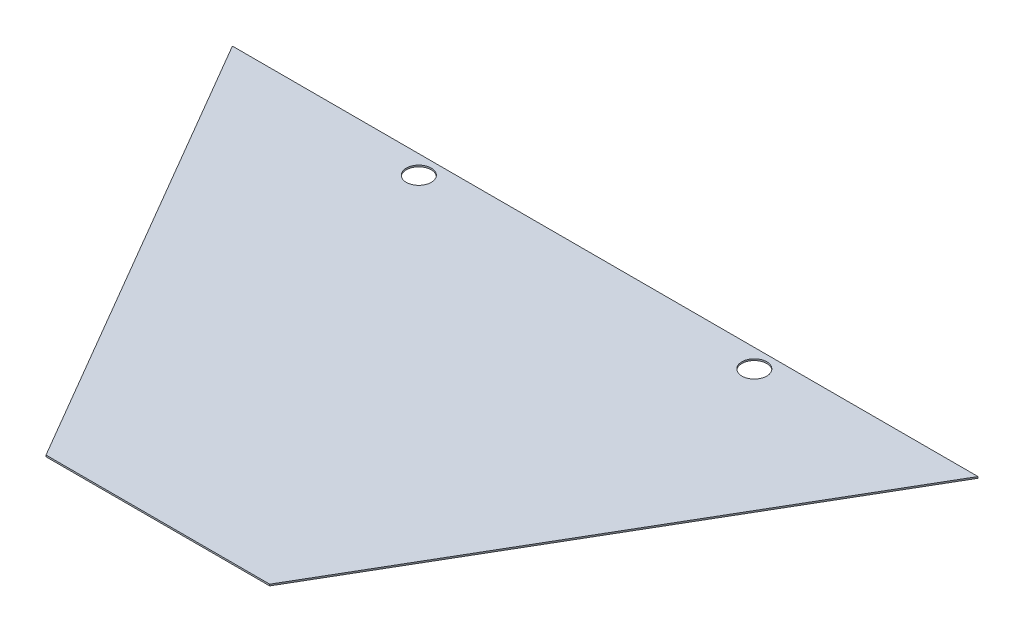
from build123d import *

# Parameters (mm, degrees)
BOSS_EXTRUDE1_DEPTH = 3.175
CUT_EXTRUDE1_REACH  = 1350.119
SKETCH2_R           = 25.4


with BuildPart() as part:
    # Sketch1 → Boss-Extrude1 (new body)
    with BuildSketch(Plane(origin=(0, 0, 0), x_dir=(1, 0, 0), z_dir=(0, 1, 0))):
        Polygon((0, 0), (457.2, 0), (990.6, 914.4), (-533.4, 914.4), align=None)
    extrude(amount=BOSS_EXTRUDE1_DEPTH)

    # Sketch2 → Cut-Extrude1 (cut, up to next)
    with BuildSketch(Plane(origin=(0, 3.175, 0), x_dir=(-1, 0, 0), z_dir=(0, 1, 0)), mode=Mode.PRIVATE) as cut_extrude1_sk1:
        with Locations((114.3, -876.3)):
            Circle(SKETCH2_R)
    cut_extrude1_tool1 = extrude(cut_extrude1_sk1.sketch, amount=-CUT_EXTRUDE1_REACH, mode=Mode.PRIVATE) & part.part
    # Sketch2 → Cut-Extrude1 (cut, up to next)
    with BuildSketch(Plane(origin=(0, 3.175, 0), x_dir=(-1, 0, 0), z_dir=(0, 1, 0)), mode=Mode.PRIVATE) as cut_extrude1_sk2:
        with Locations((-571.5, -876.3)):
            Circle(SKETCH2_R)
    cut_extrude1_tool2 = extrude(cut_extrude1_sk2.sketch, amount=-CUT_EXTRUDE1_REACH, mode=Mode.PRIVATE) & part.part
    add(cut_extrude1_tool1.solids().sort_by_distance((-114.3, 3.175, -876.3))[0], mode=Mode.SUBTRACT)
    add(cut_extrude1_tool2.solids().sort_by_distance((571.5, 3.175, -876.3))[0], mode=Mode.SUBTRACT)


solid = part.part
